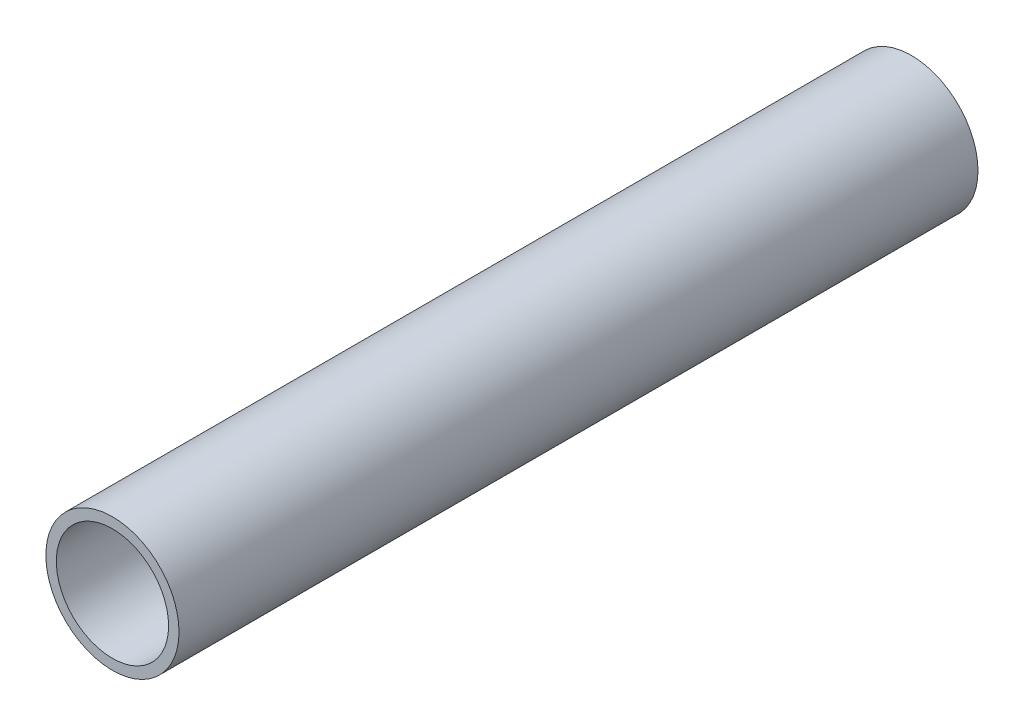
from build123d import *

# Parameters (mm, degrees)
SKETCH3_R           = 7.9375
SKETCH3_R_2         = 6.6929
BOSS_EXTRUDE1_DEPTH = 47.634581515


with BuildPart() as part:
    # Sketch3 → Boss-Extrude1 (new, symmetric)
    with BuildSketch(Plane.XY):
        Circle(SKETCH3_R)
        Circle(SKETCH3_R_2, mode=Mode.SUBTRACT)
    extrude(amount=BOSS_EXTRUDE1_DEPTH, both=True)


solid = part.part
